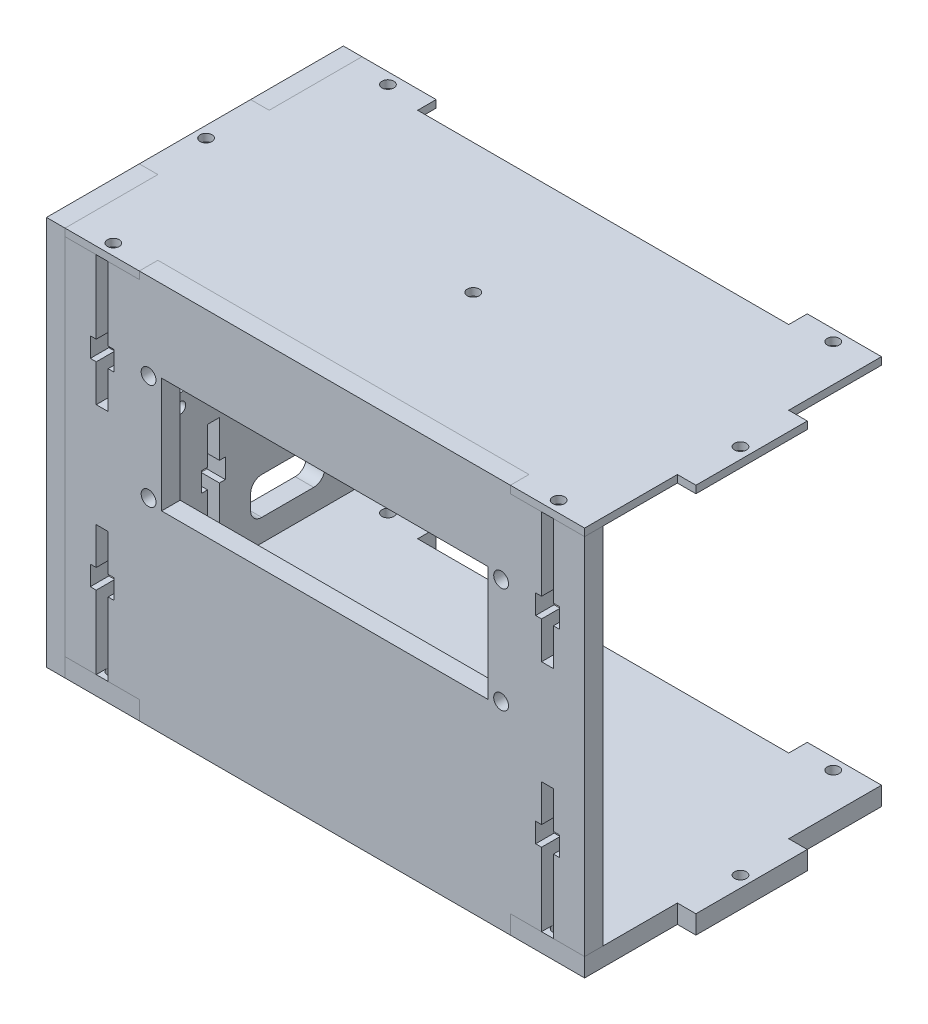
from build123d import *

# Parameters (mm, degrees)
SKETCH1_R          = 1.6
TOP_DEPTH          = 2
SKETCH4_R          = 1.6
BOT_DEPTH          = 5
BASE_FLANGE1_DEPTH = 5
SKETCH6_R          = 2
SKETCH6_W          = 88
SKETCH6_H          = 31
CUT_EXTRUDE1_DEPTH = 10
SKETCH7_R          = 1.6
SKETCH7_W          = 20
SKETCH7_H          = 10
BASE_FLANGE2_DEPTH = 5
FILLET1_R          = 3


# Sheet-metal steps are written as plain solids
with BuildPart() as part:
    # Sketch1 → top (new body)
    with BuildSketch(Plane(origin=(0, 0, 0), x_dir=(1, 0, 0), z_dir=(0, 1, 0))):
        Polygon((-70, 40), (-50, 40), (-50, 35), (50, 35), (50, 40), (70, 40), (70, 15), (75, 15), (75, -15), (70, -15), (70, -40), (50, -40), (50, -35), (-50, -35), (-50, -40), (-70, -40), (-70, -15), (-75, -15), (-75, 15), (-70, 15), align=None)
        with Locations(Location((72, 0, 0), (0, 0, 270))):
            Circle(SKETCH1_R, mode=Mode.SUBTRACT)
        with Locations(Location((60, 37, 0), (0, 0, 270))):
            Circle(SKETCH1_R, mode=Mode.SUBTRACT)
        with Locations(Location((60, -37, 0), (0, 0, 90))):
            Circle(SKETCH1_R, mode=Mode.SUBTRACT)
        with Locations(Location((-60, -37, 0), (0, 0, 270))):
            Circle(SKETCH1_R, mode=Mode.SUBTRACT)
        with Locations(Location((-72, 0, 0), (0, 0, 90))):
            Circle(SKETCH1_R, mode=Mode.SUBTRACT)
        with Locations(Location((-60, 37, 0), (0, 0, 90))):
            Circle(SKETCH1_R, mode=Mode.SUBTRACT)
        with Locations(Location((0, 0, 0), (0, 0, 270))):
            Circle(SKETCH1_R, mode=Mode.SUBTRACT)
    extrude(amount=-TOP_DEPTH)


with BuildPart() as body_2:
    # Sketch4 → bot (new body)
    with BuildSketch(Plane(origin=(0, -100, 0), x_dir=(1, 0, 0), z_dir=(0, 1, 0))):
        Polygon((-50, 35), (-50, 40), (-70, 40), (-70, 15), (-75, 15), (-75, -15), (-70, -15), (-70, -40), (-50, -40), (-50, -35), (50, -35), (50, -40), (70, -40), (70, -15), (75, -15), (75, 15), (70, 15), (70, 40), (50, 40), (50, 35), align=None)
        with Locations(Location((72, 0, 0), (0, 0, 270))):
            Circle(SKETCH4_R, mode=Mode.SUBTRACT)
        with Locations(Location((-60, 37, 0), (0, 0, 270))):
            Circle(SKETCH4_R, mode=Mode.SUBTRACT)
        with Locations(Location((-72, 0, 0), (0, 0, 270))):
            Circle(SKETCH4_R, mode=Mode.SUBTRACT)
        with Locations(Location((-60, -37, 0), (0, 0, 270))):
            Circle(SKETCH4_R, mode=Mode.SUBTRACT)
        with Locations(Location((60, -37, 0), (0, 0, 270))):
            Circle(SKETCH4_R, mode=Mode.SUBTRACT)
        with Locations(Location((60, 37, 0), (0, 0, 270))):
            Circle(SKETCH4_R, mode=Mode.SUBTRACT)
    extrude(amount=-BOT_DEPTH)


with BuildPart() as body_3:
    # Sketch5 → Base-Flange1 (new body)
    with BuildSketch(Plane.XY.offset(35)):
        Polygon((-70, -2), (-70, -100), (-61.6, -100), (-61.6, -80.28), (-63.2, -80.28), (-63.2, -75), (-61.6, -75), (-61.6, -65), (-58.4, -65), (-58.4, -75), (-56.8, -75), (-56.8, -80.28), (-58.4, -80.28), (-58.4, -100), (-50, -100), (-50, -105), (50, -105), (50, -100), (58.4, -100), (58.4, -80.28), (56.8, -80.28), (56.8, -75), (58.4, -75), (58.4, -65), (61.6, -65), (61.6, -75), (63.2, -75), (63.2, -80.28), (61.6, -80.28), (61.6, -100), (70, -100), (70, -2), (61.6, -2), (61.6, -21.72), (63.2, -21.72), (63.2, -27), (61.6, -27), (61.6, -37), (58.4, -37), (58.4, -27), (56.8, -27), (56.8, -21.72), (58.4, -21.72), (58.4, -2), (50, -2), (50, 0), (-50, 0), (-50, -2), (-58.4, -2), (-58.4, -21.72), (-56.8, -21.72), (-56.8, -27), (-58.4, -27), (-58.4, -37), (-61.6, -37), (-61.6, -27), (-63.2, -27), (-63.2, -21.72), (-61.6, -21.72), (-61.6, -2), align=None)
    extrude(amount=BASE_FLANGE1_DEPTH)

    # Sketch6 → Cut-Extrude1 (cut)
    with BuildSketch(Plane.XY.offset(40)):
        with Locations((47.5, -23.25)):
            Circle(SKETCH6_R)
        with Locations((-47.5, -23.25)):
            Circle(SKETCH6_R)
        with Locations((47.5, -51.75)):
            Circle(SKETCH6_R)
        with Locations((-47.5, -51.75)):
            Circle(SKETCH6_R)
        with Locations((0, -37.5)):
            Rectangle(SKETCH6_W, SKETCH6_H)
    extrude(amount=-CUT_EXTRUDE1_DEPTH, mode=Mode.SUBTRACT)


with BuildPart() as body_4:
    # Sketch7 → Base-Flange2 (new body)
    with BuildSketch(Plane.ZY.offset(70)):
        Polygon((40, 0), (15, 0), (15, -2), (1.6, -2), (1.6, -21.72), (3.2, -21.72), (3.2, -27), (1.6, -27), (1.6, -37), (-1.6, -37), (-1.6, -27), (-3.2, -27), (-3.2, -21.72), (-1.6, -21.72), (-1.6, -2), (-15, -2), (-15, 0), (-40, 0), (-40, -105), (-15, -105), (-15, -100), (-1.6, -100), (-1.6, -80.28), (-3.2, -80.28), (-3.2, -75), (-1.6, -75), (-1.6, -65), (1.6, -65), (1.6, -75), (3.2, -75), (3.2, -80.28), (1.6, -80.28), (1.6, -100), (15, -100), (15, -105), (40, -105), align=None)
        with Locations((19, -43)):
            Circle(SKETCH7_R, mode=Mode.SUBTRACT)
        with Locations(Location((19, -62, 0), (0, 0, 180))):
            Circle(SKETCH7_R, mode=Mode.SUBTRACT)
        with Locations(Location((-19, -43, 0), (0, 0, 180))):
            Circle(SKETCH7_R, mode=Mode.SUBTRACT)
        with Locations((-19, -62)):
            Circle(SKETCH7_R, mode=Mode.SUBTRACT)
        with Locations((37, -52.5)):
            Circle(SKETCH7_R, mode=Mode.SUBTRACT)
        with Locations(Location((-37, -52.5, 0), (0, 0, 180))):
            Circle(SKETCH7_R, mode=Mode.SUBTRACT)
        with BuildLine():
            Line((-29, -51), (-9, -51))
            ThreePointArc((-9, -51), (-7.5, -52.5), (-9, -54))
            Line((-9, -54), (-29, -54))
            ThreePointArc((-29, -54), (-30.5, -52.5), (-29, -51))
        make_face(mode=Mode.SUBTRACT)
        with BuildLine():
            Line((-29, -46), (-9, -46))
            ThreePointArc((-9, -46), (-7.5, -47.5), (-9, -49))
            Line((-9, -49), (-29, -49))
            ThreePointArc((-29, -49), (-30.5, -47.5), (-29, -46))
        make_face(mode=Mode.SUBTRACT)
        with BuildLine():
            Line((-29, -59), (-9, -59))
            ThreePointArc((-9, -59), (-7.5, -57.5), (-9, -56))
            Line((-9, -56), (-29, -56))
            ThreePointArc((-29, -56), (-30.5, -57.5), (-29, -59))
        make_face(mode=Mode.SUBTRACT)
        with BuildLine():
            Line((29, -59), (9, -59))
            ThreePointArc((9, -59), (7.5, -57.5), (9, -56))
            Line((9, -56), (29, -56))
            ThreePointArc((29, -56), (30.5, -57.5), (29, -59))
        make_face(mode=Mode.SUBTRACT)
        with BuildLine():
            Line((29, -51), (9, -51))
            ThreePointArc((9, -51), (7.5, -52.5), (9, -54))
            Line((9, -54), (29, -54))
            ThreePointArc((29, -54), (30.5, -52.5), (29, -51))
        make_face(mode=Mode.SUBTRACT)
        with BuildLine():
            Line((29, -46), (9, -46))
            ThreePointArc((9, -46), (7.5, -47.5), (9, -49))
            Line((9, -49), (29, -49))
            ThreePointArc((29, -49), (30.5, -47.5), (29, -46))
        make_face(mode=Mode.SUBTRACT)
        with Locations((20, -89)):
            Rectangle(SKETCH7_W, SKETCH7_H, mode=Mode.SUBTRACT)
        with Locations((-20, -89)):
            Rectangle(SKETCH7_W, SKETCH7_H, mode=Mode.SUBTRACT)
        with Locations((-20, -16)):
            Rectangle(SKETCH7_W, SKETCH7_H, mode=Mode.SUBTRACT)
        with Locations((20, -16)):
            Rectangle(SKETCH7_W, SKETCH7_H, mode=Mode.SUBTRACT)
    extrude(amount=BASE_FLANGE2_DEPTH)

    # Fillet1
    fillet1_edges = [body_4.edges().sort_by_distance(p)[0] for p in [
        (-72.5, -84, 10),
        (-72.5, -94, 10),
        (-72.5, -94, 30),
        (-72.5, -84, 30),
        (-72.5, -94, -10),
        (-72.5, -84, -10),
        (-72.5, -84, -30),
        (-72.5, -94, -30),
        (-72.5, -11, -10),
        (-72.5, -11, -30),
        (-72.5, -21, -30),
        (-72.5, -21, -10),
        (-72.5, -11, 30),
        (-72.5, -11, 10),
        (-72.5, -21, 10),
        (-72.5, -21, 30),
    ]]
    fillet(fillet1_edges, radius=FILLET1_R)


solid = Compound([part.part, body_2.part, body_3.part, body_4.part])
